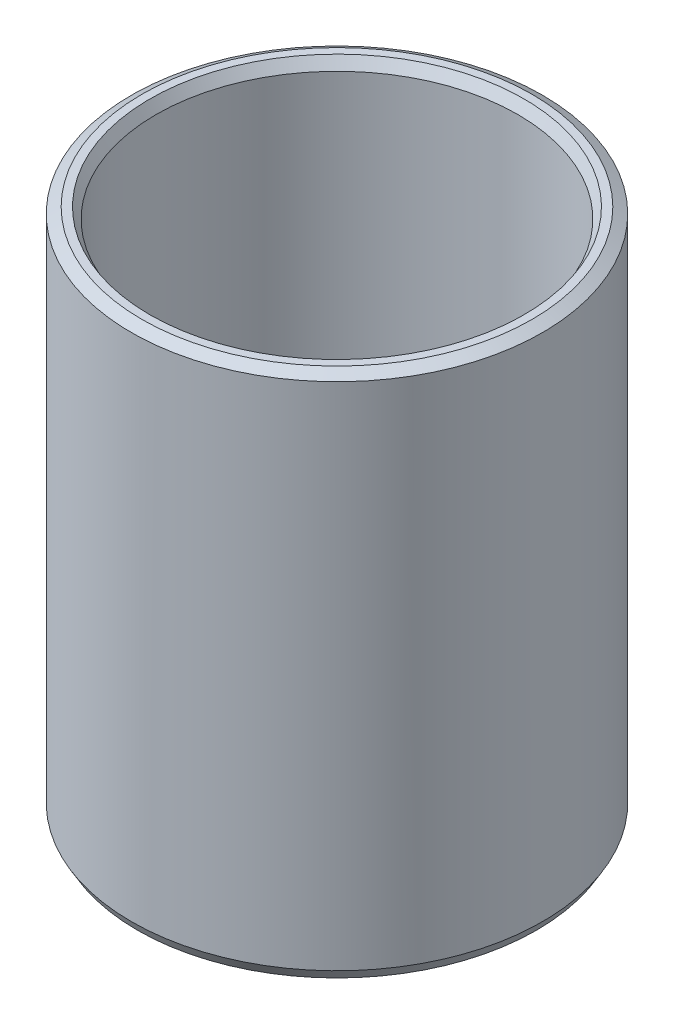
from build123d import *
from OCP.BRepFilletAPI import BRepFilletAPI_MakeChamfer

# Parameters (mm, degrees)
SKETCH1_R           = 42.5
BOSS_EXTRUDE1_DEPTH = 108.89076787
SKETCH2_R           = 37.405197761
CUT_EXTRUDE1_DEPTH  = 125.377246019
CHAMFER1_SIZE       = 1.258360476
CHAMFER1_SIZE2      = 2.179544279


with BuildPart() as part:
    # Sketch1 → Boss-Extrude1 (new body)
    with BuildSketch(Plane(origin=(0, 0, 0), x_dir=(1, 0, 0), z_dir=(0, 1, 0))):
        Circle(SKETCH1_R)
    extrude(amount=BOSS_EXTRUDE1_DEPTH)

    # Sketch2 → Cut-Extrude1 (cut, through all)
    with BuildSketch(Plane(origin=(0, 0, 0), x_dir=(1, 0, 0), z_dir=(0, 1, 0))):
        Circle(SKETCH2_R)
    extrude(amount=CUT_EXTRUDE1_DEPTH, mode=Mode.SUBTRACT)

    # Chamfer1: one chamfer whose edges measure the first distance from different faces: ONE call of the kernel's chamfer builder (chamfer() names one face for all edges)
    chamfer1_edges_1 = [part.edges().sort_by_distance(p)[0] for p in [
        (-37.405197761, 108.89076787, 0),
    ]]
    chamfer1_side_1 = [part.faces().sort_by_distance(p)[0] for p in [
        (-41.297918472, 108.89076787, 0),
    ]]
    chamfer1_edges_2 = [part.edges().sort_by_distance(p)[0] for p in [
        (-37.405197761, 0, 0),
    ]]
    chamfer1_side_2 = [part.faces().sort_by_distance(p)[0] for p in [
        (-37.405197761, 54.445383935, 0),
    ]]
    chamfer1_edges_3 = [part.edges().sort_by_distance(p)[0] for p in [
        (-42.5, 0, 0),
    ]]
    chamfer1_side_3 = [part.faces().sort_by_distance(p)[0] for p in [
        (-41.297918472, 0, 0),
    ]]
    chamfer1_edges_4 = [part.edges().sort_by_distance(p)[0] for p in [
        (-42.5, 108.89076787, 0),
    ]]
    chamfer1_side_4 = [part.faces().sort_by_distance(p)[0] for p in [
        (-42.5, 54.445383935, 0),
    ]]
    chamfer1 = BRepFilletAPI_MakeChamfer(part.part.solid().wrapped)
    for e in chamfer1_edges_1:
        chamfer1.Add(CHAMFER1_SIZE, CHAMFER1_SIZE2, e.wrapped, chamfer1_side_1[0].wrapped)  # the first distance lies on this face
    for e in chamfer1_edges_2:
        chamfer1.Add(CHAMFER1_SIZE, CHAMFER1_SIZE2, e.wrapped, chamfer1_side_2[0].wrapped)  # the first distance lies on this face
    for e in chamfer1_edges_3:
        chamfer1.Add(CHAMFER1_SIZE, CHAMFER1_SIZE2, e.wrapped, chamfer1_side_3[0].wrapped)  # the first distance lies on this face
    for e in chamfer1_edges_4:
        chamfer1.Add(CHAMFER1_SIZE, CHAMFER1_SIZE2, e.wrapped, chamfer1_side_4[0].wrapped)  # the first distance lies on this face
    add(Compound.cast(chamfer1.Shape()), mode=Mode.REPLACE)


solid = part.part
